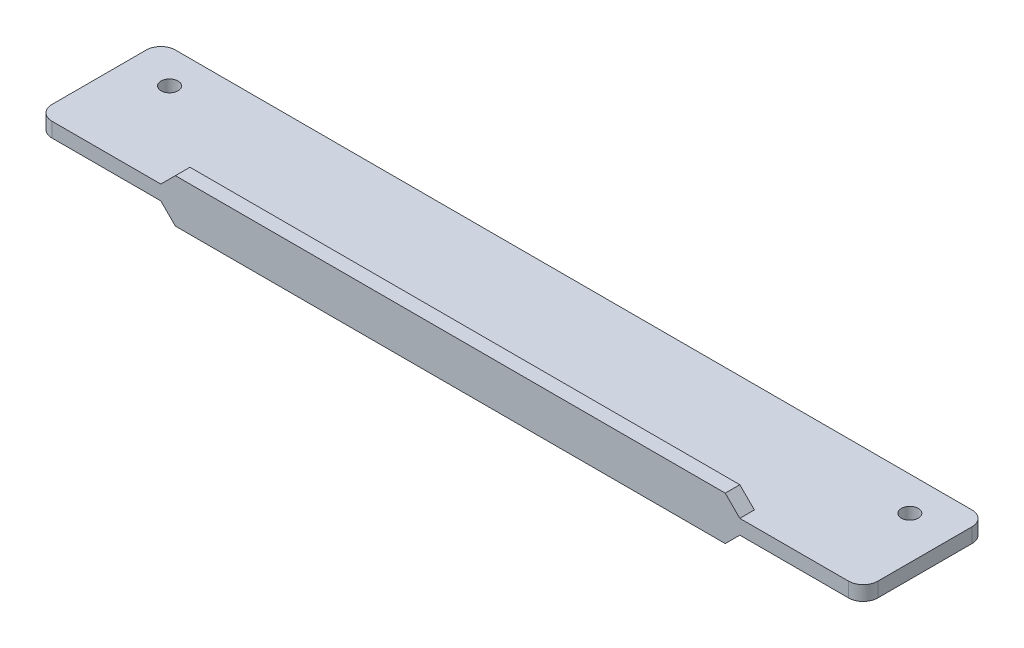
from build123d import *

# Parameters (mm, degrees)
SKETCH1_W           = 170
SKETCH1_H           = 25.4
BOSS_EXTRUDE1_DEPTH = 3
FILLET1_R           = 3
SKETCH2_R           = 1.75
CUT_EXTRUDE1_DEPTH  = 3
SKETCH3_W           = 119.2
SKETCH3_H           = 9
BOSS_EXTRUDE2_DEPTH = 3
CHAMFER1_SIZE       = 3


with BuildPart() as part:
    # Sketch1 → Boss-Extrude1 (new body)
    with BuildSketch(Plane(origin=(0, 0, 0), x_dir=(1, 0, 0), z_dir=(0, 1, 0))):
        with Locations((10.053763441, 8.016845878)):
            Rectangle(SKETCH1_W, SKETCH1_H)
    extrude(amount=BOSS_EXTRUDE1_DEPTH)

    # Fillet1
    fillet1_edges = [part.edges().sort_by_distance(p)[0] for p in [
        (-74.946236559, 1.5, -20.716845878),
        (95.053763441, 1.5, -20.716845878),
        (95.053763441, 1.5, 4.683154122),
        (-74.946236559, 1.5, 4.683154122),
    ]]
    fillet(fillet1_edges, radius=FILLET1_R)

    # Sketch2 → Cut-Extrude1 (cut)
    with BuildSketch(Plane(origin=(0, 3, 0), x_dir=(1, 0, 0), z_dir=(0, 1, 0))):
        with Locations(Location((86.253763441, 13.716845878, 0), (0, 0, 270))):
            Circle(SKETCH2_R)
        with Locations(Location((-66.146236559, 13.716845878, 0), (0, 0, 270))):
            Circle(SKETCH2_R)
    extrude(amount=-CUT_EXTRUDE1_DEPTH, mode=Mode.SUBTRACT)

    # Sketch3 → Boss-Extrude2 (add)
    with BuildSketch(Plane.XY.offset(4.683154122)):
        with Locations((10.053763441, 1.5)):
            Rectangle(SKETCH3_W, SKETCH3_H)
    extrude(amount=-BOSS_EXTRUDE2_DEPTH)

    # Chamfer1
    chamfer1_edges = [part.edges().sort_by_distance(p)[0] for p in [
        (-49.546236559, -3, 3.183154122),
        (69.653763441, -3, 3.183154122),
        (69.653763441, 6, 3.183154122),
        (-49.546236559, 6, 3.183154122),
    ]]
    chamfer(chamfer1_edges, length=CHAMFER1_SIZE - 0.0001)  # a hair under: the kernel refuses the full size


solid = part.part
